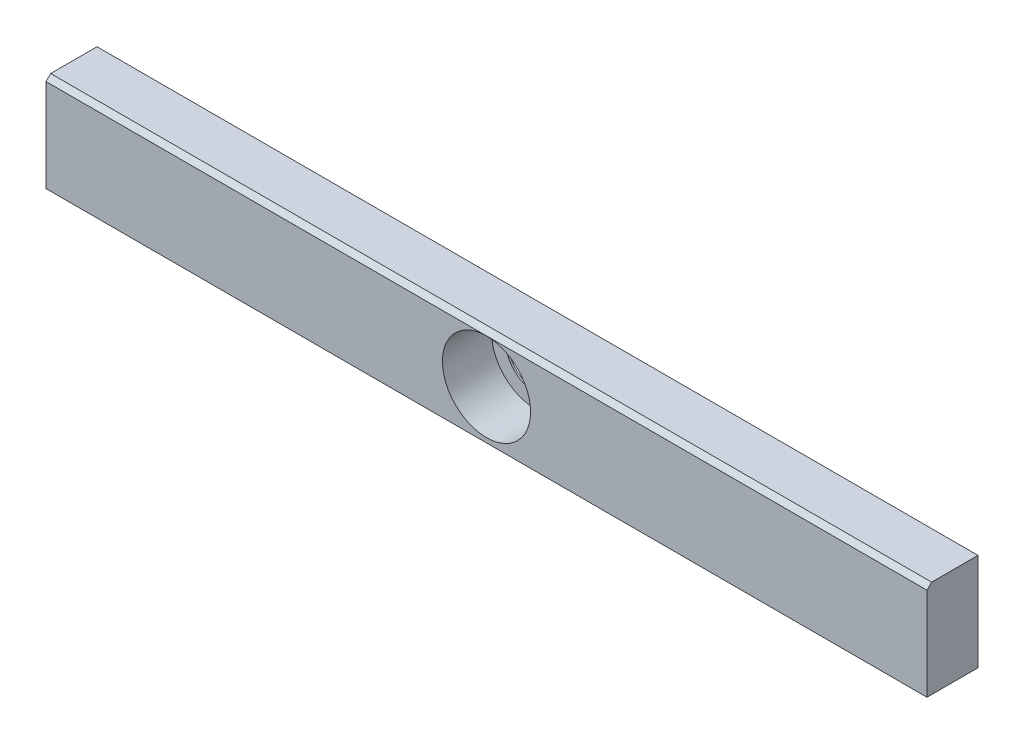
from build123d import *

# Parameters (mm, degrees)
SKETCH1_W           = 950
SKETCH1_H           = 105
BOSS_EXTRUDE1_DEPTH = 27.5
SKETCH2_R           = 47.5
CUT_EXTRUDE1_DEPTH  = 53
SKETCH3_R           = 32.5
CUT_EXTRUDE2_DEPTH  = 481.822472437
CHAMFER1_SIZE       = 5


with BuildPart() as part:
    # Sketch1 → Boss-Extrude1 (new, symmetric)
    with BuildSketch(Plane.XY):
        Rectangle(SKETCH1_W, SKETCH1_H)
    extrude(amount=BOSS_EXTRUDE1_DEPTH, both=True)

    # Sketch2 → Cut-Extrude1 (cut)
    with BuildSketch(Plane.XY.offset(27.5)):
        Circle(SKETCH2_R)
    extrude(amount=-CUT_EXTRUDE1_DEPTH, mode=Mode.SUBTRACT)

    # Sketch3 → Cut-Extrude2 (cut, through all)
    with BuildSketch(Plane.XY.offset(-25.5)):
        Circle(SKETCH3_R)
    extrude(amount=-CUT_EXTRUDE2_DEPTH, mode=Mode.SUBTRACT)

    # Chamfer1
    chamfer1_edges = [part.edges().sort_by_distance(p)[0] for p in [
        (0, 52.5, 27.5),
    ]]
    chamfer(chamfer1_edges, length=CHAMFER1_SIZE - 0.0001)  # a hair under: the kernel refuses the full size


solid = part.part
